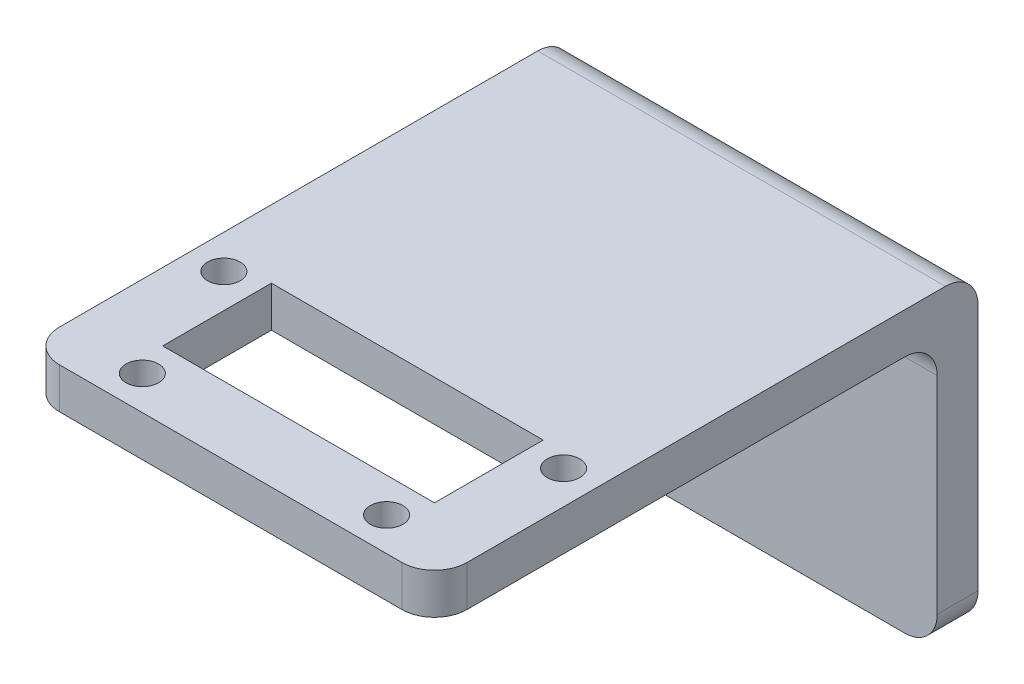
from build123d import *

# Parameters (mm, degrees)
ESBO_O1_W                = 30
ESBO_O1_H                = 40
RESSALTO_EXTRUS_O1_DEPTH = 3
ESBO_O2_W                = 20
ESBO_O2_H                = 8
CORTE_EXTRUS_O1_DEPTH    = 26.179356624
ESBO_O3_R                = 1.2
CORTE_EXTRUS_O2_DEPTH    = 26.179356624
ESBO_O4_W                = 30
ESBO_O4_H                = 3
RESSALTO_EXTRUS_O2_DEPTH = 20
FILETE5_R                = 2.4
FILETE6_R                = 2.4
FILETE7_R                = 2.4
FILETE8_R                = 2.4


with BuildPart() as part:
    # Esboço1 → Ressalto-extrusão1 (new body)
    with BuildSketch(Plane(origin=(0, 0, 0), x_dir=(1, 0, 0), z_dir=(0, 1, 0))):
        Rectangle(ESBO_O1_W, ESBO_O1_H)
    extrude(amount=RESSALTO_EXTRUS_O1_DEPTH)

    # Esboço2 → Corte-extrusão1 (cut, through all)
    with BuildSketch(Plane(origin=(0, 3, 0), x_dir=(1, 0, 0), z_dir=(0, 1, 0))):
        with Locations((0, -11)):
            Rectangle(ESBO_O2_W, ESBO_O2_H)
    extrude(amount=-CORTE_EXTRUS_O1_DEPTH, mode=Mode.SUBTRACT)

    # Esboço3 → Corte-extrusão2 (cut, through all)
    with BuildSketch(Plane.XZ):
        with Locations((-9, 17.5)):
            Circle(ESBO_O3_R)
        with Locations((-12.5, 8)):
            Circle(ESBO_O3_R)
        with Locations((12.545132566, 8.047190753)):
            Circle(ESBO_O3_R)
        with Locations((9.009357204, 17.533933744)):
            Circle(ESBO_O3_R)
    extrude(amount=-CORTE_EXTRUS_O2_DEPTH, mode=Mode.SUBTRACT)

    # Esboço4 → Ressalto-extrusão2 (add)
    with BuildSketch(Plane.XZ):
        with Locations((0, -18.5)):
            Rectangle(ESBO_O4_W, ESBO_O4_H)
    extrude(amount=RESSALTO_EXTRUS_O2_DEPTH)

    # Filete5
    filete5_edges = [part.edges().sort_by_distance(p)[0] for p in [
        (0, 0, -17),
    ]]
    fillet(filete5_edges, radius=FILETE5_R)

    # Filete6
    filete6_edges = [part.edges().sort_by_distance(p)[0] for p in [
        (0, 3, -20),
    ]]
    fillet(filete6_edges, radius=FILETE6_R)

    # Filete7
    filete7_edges = [part.edges().sort_by_distance(p)[0] for p in [
        (15, 1.5, 20),
        (-15, 1.5, 20),
    ]]
    fillet(filete7_edges, radius=FILETE7_R)

    # Filete8
    filete8_edges = [part.edges().sort_by_distance(p)[0] for p in [
        (15, -20, -18.5),
        (-15, -20, -18.5),
    ]]
    fillet(filete8_edges, radius=FILETE8_R)


solid = part.part
